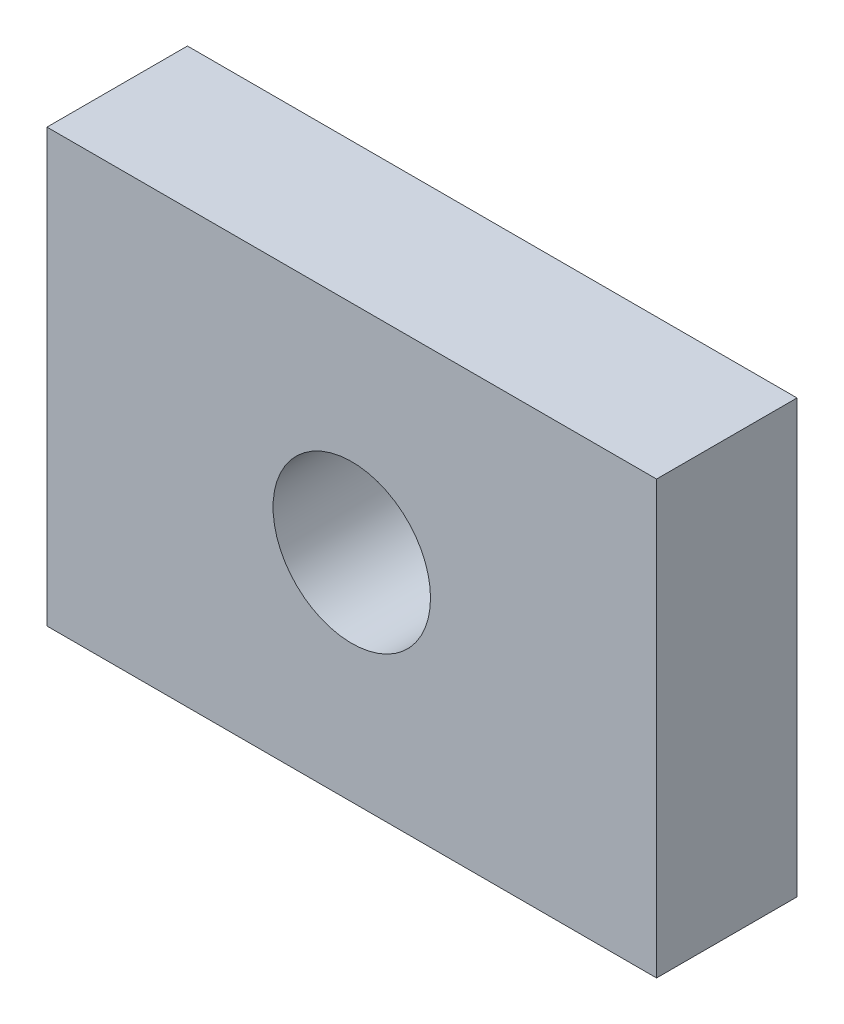
from build123d import *

# Parameters (mm, degrees)
SKETCH1_W           = 110.237040332
SKETCH1_H           = 78.14500721
BOSS_EXTRUDE1_DEPTH = 25.4
SKETCH2_R           = 14.236538706
CUT_EXTRUDE1_DEPTH  = 73.179441694


with BuildPart() as part:
    # Sketch1 → Boss-Extrude1 (new body)
    with BuildSketch(Plane.XY):
        Rectangle(SKETCH1_W, SKETCH1_H)
    extrude(amount=-BOSS_EXTRUDE1_DEPTH)

    # Sketch2 → Cut-Extrude1 (cut, through all)
    with BuildSketch(Plane.XY):
        Circle(SKETCH2_R)
    extrude(amount=-CUT_EXTRUDE1_DEPTH, mode=Mode.SUBTRACT)


solid = part.part
